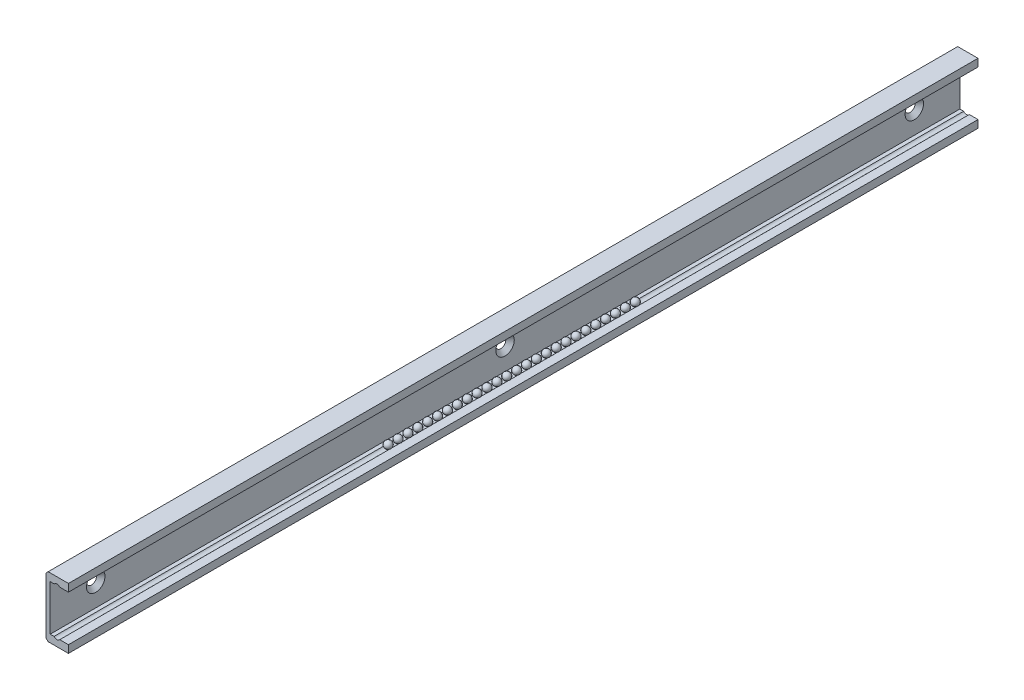
from build123d import *

# Parameters (mm, degrees)
BOSS_EXTRUDE1_DEPTH = 300


with BuildPart() as part:
    # Sketch1 → Boss-Extrude1 (new body)
    with BuildSketch(Plane.XY):
        with BuildLine():
            Line((-7.4, 0.707106781), (-6.692893219, 0))
            Line((-6.692893219, 0), (0, 0))
            Line((0, 0), (0, 2.5))
            Line((0, 2.5), (-2.8632503, 2.5))
            ThreePointArc((-2.8632503, 2.5), (-3.8, 2.05), (-4.7367497, 2.5))
            Line((-4.7367497, 2.5), (-6, 2.5))
            Line((-6, 2.5), (-6, 17.5))
            Line((-6, 17.5), (-4.7367497, 17.5))
            ThreePointArc((-4.7367497, 17.5), (-3.8, 17.95), (-2.8632503, 17.5))
            Line((-2.8632503, 17.5), (0, 17.5))
            Line((0, 17.5), (0, 20))
            Line((0, 20), (-6.692893219, 20))
            Line((-6.692893219, 20), (-7.4, 19.292893219))
            Line((-7.4, 19.292893219), (-7.4, 0.707106781))
        make_face()
    extrude(amount=BOSS_EXTRUDE1_DEPTH)

    # Sketch2 → Cut-Revolve1 (revolve, cut)
    with BuildSketch(Plane.XY.offset(15)):
        Polygon((-7.4, 10), (-7.4, 11.65), (-6, 13.05), (-6, 10), align=None)
    revolve(axis=Axis((-6, 10, 15), (-1, 0, 0)), mode=Mode.SUBTRACT)

    # Sketch3 → Cut-Revolve2 (revolve, cut)
    with BuildSketch(Plane.XY.offset(285)):
        Polygon((-7.4, 10), (-7.4, 11.65), (-6, 13.05), (-6, 10), align=None)
    revolve(axis=Axis((-6, 10, 285), (-1, 0, 0)), mode=Mode.SUBTRACT)

    # Sketch4 → Cut-Revolve3 (revolve, cut)
    with BuildSketch(Plane.XY.offset(150)):
        Polygon((-7.4, 10), (-7.4, 11.65), (-6, 13.05), (-6, 10), align=None)
    revolve(axis=Axis((-6, 10, 150), (-1, 0, 0)), mode=Mode.SUBTRACT)

    # Sketch5 → Revolve1 (revolve)
    with BuildSketch(Plane(origin=(0, 3.14999, 0), x_dir=(1, 0, 0), z_dir=(0, 1, 0))):
        with BuildLine():
            Line((-3.8, -110.45), (-3.8, -108.05))
            ThreePointArc((-3.8, -108.05), (-2.6, -109.25), (-3.8, -110.45))
        make_face()
    revolve(axis=Axis((-3.8, 3.14999, 110.45), (0, 0, -1)))

    # Sketch6 → Revolve2 (revolve)
    with BuildSketch(Plane(origin=(0, 3.14999, 0), x_dir=(1, 0, 0), z_dir=(0, 1, 0))):
        with BuildLine():
            Line((-3.8, -113.71), (-3.8, -111.31))
            ThreePointArc((-3.8, -111.31), (-2.6, -112.51), (-3.8, -113.71))
        make_face()
    revolve(axis=Axis((-3.8, 3.14999, 113.71), (0, 0, -1)))

    # Sketch7 → Revolve3 (revolve)
    with BuildSketch(Plane(origin=(0, 3.14999, 0), x_dir=(1, 0, 0), z_dir=(0, 1, 0))):
        with BuildLine():
            Line((-3.8, -116.97), (-3.8, -114.57))
            ThreePointArc((-3.8, -114.57), (-2.6, -115.77), (-3.8, -116.97))
        make_face()
    revolve(axis=Axis((-3.8, 3.14999, 116.97), (0, 0, -1)))

    # Sketch8 → Revolve4 (revolve)
    with BuildSketch(Plane(origin=(0, 3.14999, 0), x_dir=(1, 0, 0), z_dir=(0, 1, 0))):
        with BuildLine():
            Line((-3.8, -120.23), (-3.8, -117.83))
            ThreePointArc((-3.8, -117.83), (-2.6, -119.03), (-3.8, -120.23))
        make_face()
    revolve(axis=Axis((-3.8, 3.14999, 120.23), (0, 0, -1)))

    # Sketch9 → Revolve5 (revolve)
    with BuildSketch(Plane(origin=(0, 3.14999, 0), x_dir=(1, 0, 0), z_dir=(0, 1, 0))):
        with BuildLine():
            Line((-3.8, -123.49), (-3.8, -121.09))
            ThreePointArc((-3.8, -121.09), (-2.6, -122.29), (-3.8, -123.49))
        make_face()
    revolve(axis=Axis((-3.8, 3.14999, 123.49), (0, 0, -1)))

    # Sketch10 → Revolve6 (revolve)
    with BuildSketch(Plane(origin=(0, 3.14999, 0), x_dir=(1, 0, 0), z_dir=(0, 1, 0))):
        with BuildLine():
            Line((-3.8, -126.75), (-3.8, -124.35))
            ThreePointArc((-3.8, -124.35), (-2.6, -125.55), (-3.8, -126.75))
        make_face()
    revolve(axis=Axis((-3.8, 3.14999, 126.75), (0, 0, -1)))

    # Sketch11 → Revolve7 (revolve)
    with BuildSketch(Plane(origin=(0, 3.14999, 0), x_dir=(1, 0, 0), z_dir=(0, 1, 0))):
        with BuildLine():
            Line((-3.8, -130.01), (-3.8, -127.61))
            ThreePointArc((-3.8, -127.61), (-2.6, -128.81), (-3.8, -130.01))
        make_face()
    revolve(axis=Axis((-3.8, 3.14999, 130.01), (0, 0, -1)))

    # Sketch12 → Revolve8 (revolve)
    with BuildSketch(Plane(origin=(0, 3.14999, 0), x_dir=(1, 0, 0), z_dir=(0, 1, 0))):
        with BuildLine():
            Line((-3.8, -133.27), (-3.8, -130.87))
            ThreePointArc((-3.8, -130.87), (-2.6, -132.07), (-3.8, -133.27))
        make_face()
    revolve(axis=Axis((-3.8, 3.14999, 133.27), (0, 0, -1)))

    # Sketch13 → Revolve9 (revolve)
    with BuildSketch(Plane(origin=(0, 3.14999, 0), x_dir=(1, 0, 0), z_dir=(0, 1, 0))):
        with BuildLine():
            Line((-3.8, -136.53), (-3.8, -134.13))
            ThreePointArc((-3.8, -134.13), (-2.6, -135.33), (-3.8, -136.53))
        make_face()
    revolve(axis=Axis((-3.8, 3.14999, 136.53), (0, 0, -1)))

    # Sketch14 → Revolve10 (revolve)
    with BuildSketch(Plane(origin=(0, 3.14999, 0), x_dir=(1, 0, 0), z_dir=(0, 1, 0))):
        with BuildLine():
            Line((-3.8, -139.79), (-3.8, -137.39))
            ThreePointArc((-3.8, -137.39), (-2.6, -138.59), (-3.8, -139.79))
        make_face()
    revolve(axis=Axis((-3.8, 3.14999, 139.79), (0, 0, -1)))

    # Sketch15 → Revolve11 (revolve)
    with BuildSketch(Plane(origin=(0, 3.14999, 0), x_dir=(1, 0, 0), z_dir=(0, 1, 0))):
        with BuildLine():
            Line((-3.8, -143.05), (-3.8, -140.65))
            ThreePointArc((-3.8, -140.65), (-2.6, -141.85), (-3.8, -143.05))
        make_face()
    revolve(axis=Axis((-3.8, 3.14999, 143.05), (0, 0, -1)))

    # Sketch16 → Revolve12 (revolve)
    with BuildSketch(Plane(origin=(0, 3.14999, 0), x_dir=(1, 0, 0), z_dir=(0, 1, 0))):
        with BuildLine():
            Line((-3.8, -146.31), (-3.8, -143.91))
            ThreePointArc((-3.8, -143.91), (-2.6, -145.11), (-3.8, -146.31))
        make_face()
    revolve(axis=Axis((-3.8, 3.14999, 146.31), (0, 0, -1)))

    # Sketch17 → Revolve13 (revolve)
    with BuildSketch(Plane(origin=(0, 3.14999, 0), x_dir=(1, 0, 0), z_dir=(0, 1, 0))):
        with BuildLine():
            Line((-3.8, -149.57), (-3.8, -147.17))
            ThreePointArc((-3.8, -147.17), (-2.6, -148.37), (-3.8, -149.57))
        make_face()
    revolve(axis=Axis((-3.8, 3.14999, 149.57), (0, 0, -1)))

    # Sketch18 → Revolve14 (revolve)
    with BuildSketch(Plane(origin=(0, 3.14999, 0), x_dir=(1, 0, 0), z_dir=(0, 1, 0))):
        with BuildLine():
            Line((-3.8, -152.83), (-3.8, -150.43))
            ThreePointArc((-3.8, -150.43), (-2.6, -151.63), (-3.8, -152.83))
        make_face()
    revolve(axis=Axis((-3.8, 3.14999, 152.83), (0, 0, -1)))

    # Sketch19 → Revolve15 (revolve)
    with BuildSketch(Plane(origin=(0, 3.14999, 0), x_dir=(1, 0, 0), z_dir=(0, 1, 0))):
        with BuildLine():
            Line((-3.8, -156.09), (-3.8, -153.69))
            ThreePointArc((-3.8, -153.69), (-2.6, -154.89), (-3.8, -156.09))
        make_face()
    revolve(axis=Axis((-3.8, 3.14999, 156.09), (0, 0, -1)))

    # Sketch20 → Revolve16 (revolve)
    with BuildSketch(Plane(origin=(0, 3.14999, 0), x_dir=(1, 0, 0), z_dir=(0, 1, 0))):
        with BuildLine():
            Line((-3.8, -159.35), (-3.8, -156.95))
            ThreePointArc((-3.8, -156.95), (-2.6, -158.15), (-3.8, -159.35))
        make_face()
    revolve(axis=Axis((-3.8, 3.14999, 159.35), (0, 0, -1)))

    # Sketch21 → Revolve17 (revolve)
    with BuildSketch(Plane(origin=(0, 3.14999, 0), x_dir=(1, 0, 0), z_dir=(0, 1, 0))):
        with BuildLine():
            Line((-3.8, -162.61), (-3.8, -160.21))
            ThreePointArc((-3.8, -160.21), (-2.6, -161.41), (-3.8, -162.61))
        make_face()
    revolve(axis=Axis((-3.8, 3.14999, 162.61), (0, 0, -1)))

    # Sketch22 → Revolve18 (revolve)
    with BuildSketch(Plane(origin=(0, 3.14999, 0), x_dir=(1, 0, 0), z_dir=(0, 1, 0))):
        with BuildLine():
            Line((-3.8, -165.87), (-3.8, -163.47))
            ThreePointArc((-3.8, -163.47), (-2.6, -164.67), (-3.8, -165.87))
        make_face()
    revolve(axis=Axis((-3.8, 3.14999, 165.87), (0, 0, -1)))

    # Sketch23 → Revolve19 (revolve)
    with BuildSketch(Plane(origin=(0, 3.14999, 0), x_dir=(1, 0, 0), z_dir=(0, 1, 0))):
        with BuildLine():
            Line((-3.8, -169.13), (-3.8, -166.73))
            ThreePointArc((-3.8, -166.73), (-2.6, -167.93), (-3.8, -169.13))
        make_face()
    revolve(axis=Axis((-3.8, 3.14999, 169.13), (0, 0, -1)))

    # Sketch24 → Revolve20 (revolve)
    with BuildSketch(Plane(origin=(0, 3.14999, 0), x_dir=(1, 0, 0), z_dir=(0, 1, 0))):
        with BuildLine():
            Line((-3.8, -172.39), (-3.8, -169.99))
            ThreePointArc((-3.8, -169.99), (-2.6, -171.19), (-3.8, -172.39))
        make_face()
    revolve(axis=Axis((-3.8, 3.14999, 172.39), (0, 0, -1)))

    # Sketch25 → Revolve21 (revolve)
    with BuildSketch(Plane(origin=(0, 3.14999, 0), x_dir=(1, 0, 0), z_dir=(0, 1, 0))):
        with BuildLine():
            Line((-3.8, -175.65), (-3.8, -173.25))
            ThreePointArc((-3.8, -173.25), (-2.6, -174.45), (-3.8, -175.65))
        make_face()
    revolve(axis=Axis((-3.8, 3.14999, 175.65), (0, 0, -1)))

    # Sketch26 → Revolve22 (revolve)
    with BuildSketch(Plane(origin=(0, 3.14999, 0), x_dir=(1, 0, 0), z_dir=(0, 1, 0))):
        with BuildLine():
            Line((-3.8, -178.91), (-3.8, -176.51))
            ThreePointArc((-3.8, -176.51), (-2.6, -177.71), (-3.8, -178.91))
        make_face()
    revolve(axis=Axis((-3.8, 3.14999, 178.91), (0, 0, -1)))

    # Sketch27 → Revolve23 (revolve)
    with BuildSketch(Plane(origin=(0, 3.14999, 0), x_dir=(1, 0, 0), z_dir=(0, 1, 0))):
        with BuildLine():
            Line((-3.8, -182.17), (-3.8, -179.77))
            ThreePointArc((-3.8, -179.77), (-2.6, -180.97), (-3.8, -182.17))
        make_face()
    revolve(axis=Axis((-3.8, 3.14999, 182.17), (0, 0, -1)))

    # Sketch28 → Revolve24 (revolve)
    with BuildSketch(Plane(origin=(0, 3.14999, 0), x_dir=(1, 0, 0), z_dir=(0, 1, 0))):
        with BuildLine():
            Line((-3.8, -185.43), (-3.8, -183.03))
            ThreePointArc((-3.8, -183.03), (-2.6, -184.23), (-3.8, -185.43))
        make_face()
    revolve(axis=Axis((-3.8, 3.14999, 185.43), (0, 0, -1)))

    # Sketch29 → Revolve25 (revolve)
    with BuildSketch(Plane(origin=(0, 3.14999, 0), x_dir=(1, 0, 0), z_dir=(0, 1, 0))):
        with BuildLine():
            Line((-3.8, -188.69), (-3.8, -186.29))
            ThreePointArc((-3.8, -186.29), (-2.6, -187.49), (-3.8, -188.69))
        make_face()
    revolve(axis=Axis((-3.8, 3.14999, 188.69), (0, 0, -1)))

    # Sketch30 → Revolve26 (revolve)
    with BuildSketch(Plane(origin=(0, 3.14999, 0), x_dir=(1, 0, 0), z_dir=(0, 1, 0))):
        with BuildLine():
            Line((-3.8, -191.95), (-3.8, -189.55))
            ThreePointArc((-3.8, -189.55), (-2.6, -190.75), (-3.8, -191.95))
        make_face()
    revolve(axis=Axis((-3.8, 3.14999, 191.95), (0, 0, -1)))

    # Sketch31 → Revolve27 (revolve)
    with BuildSketch(Plane(origin=(0, 16.85001, 0), x_dir=(1, 0, 0), z_dir=(0, 1, 0))):
        with BuildLine():
            Line((-3.8, -110.45), (-3.8, -108.05))
            ThreePointArc((-3.8, -108.05), (-2.6, -109.25), (-3.8, -110.45))
        make_face()
    revolve(axis=Axis((-3.8, 16.85001, 110.45), (0, 0, -1)))

    # Sketch32 → Revolve28 (revolve)
    with BuildSketch(Plane(origin=(0, 16.85001, 0), x_dir=(1, 0, 0), z_dir=(0, 1, 0))):
        with BuildLine():
            Line((-3.8, -113.71), (-3.8, -111.31))
            ThreePointArc((-3.8, -111.31), (-2.6, -112.51), (-3.8, -113.71))
        make_face()
    revolve(axis=Axis((-3.8, 16.85001, 113.71), (0, 0, -1)))

    # Sketch33 → Revolve29 (revolve)
    with BuildSketch(Plane(origin=(0, 16.85001, 0), x_dir=(1, 0, 0), z_dir=(0, 1, 0))):
        with BuildLine():
            Line((-3.8, -116.97), (-3.8, -114.57))
            ThreePointArc((-3.8, -114.57), (-2.6, -115.77), (-3.8, -116.97))
        make_face()
    revolve(axis=Axis((-3.8, 16.85001, 116.97), (0, 0, -1)))

    # Sketch34 → Revolve30 (revolve)
    with BuildSketch(Plane(origin=(0, 16.85001, 0), x_dir=(1, 0, 0), z_dir=(0, 1, 0))):
        with BuildLine():
            Line((-3.8, -120.23), (-3.8, -117.83))
            ThreePointArc((-3.8, -117.83), (-2.6, -119.03), (-3.8, -120.23))
        make_face()
    revolve(axis=Axis((-3.8, 16.85001, 120.23), (0, 0, -1)))

    # Sketch35 → Revolve31 (revolve)
    with BuildSketch(Plane(origin=(0, 16.85001, 0), x_dir=(1, 0, 0), z_dir=(0, 1, 0))):
        with BuildLine():
            Line((-3.8, -123.49), (-3.8, -121.09))
            ThreePointArc((-3.8, -121.09), (-2.6, -122.29), (-3.8, -123.49))
        make_face()
    revolve(axis=Axis((-3.8, 16.85001, 123.49), (0, 0, -1)))

    # Sketch36 → Revolve32 (revolve)
    with BuildSketch(Plane(origin=(0, 16.85001, 0), x_dir=(1, 0, 0), z_dir=(0, 1, 0))):
        with BuildLine():
            Line((-3.8, -126.75), (-3.8, -124.35))
            ThreePointArc((-3.8, -124.35), (-2.6, -125.55), (-3.8, -126.75))
        make_face()
    revolve(axis=Axis((-3.8, 16.85001, 126.75), (0, 0, -1)))

    # Sketch37 → Revolve33 (revolve)
    with BuildSketch(Plane(origin=(0, 16.85001, 0), x_dir=(1, 0, 0), z_dir=(0, 1, 0))):
        with BuildLine():
            Line((-3.8, -130.01), (-3.8, -127.61))
            ThreePointArc((-3.8, -127.61), (-2.6, -128.81), (-3.8, -130.01))
        make_face()
    revolve(axis=Axis((-3.8, 16.85001, 130.01), (0, 0, -1)))

    # Sketch38 → Revolve34 (revolve)
    with BuildSketch(Plane(origin=(0, 16.85001, 0), x_dir=(1, 0, 0), z_dir=(0, 1, 0))):
        with BuildLine():
            Line((-3.8, -133.27), (-3.8, -130.87))
            ThreePointArc((-3.8, -130.87), (-2.6, -132.07), (-3.8, -133.27))
        make_face()
    revolve(axis=Axis((-3.8, 16.85001, 133.27), (0, 0, -1)))

    # Sketch39 → Revolve35 (revolve)
    with BuildSketch(Plane(origin=(0, 16.85001, 0), x_dir=(1, 0, 0), z_dir=(0, 1, 0))):
        with BuildLine():
            Line((-3.8, -136.53), (-3.8, -134.13))
            ThreePointArc((-3.8, -134.13), (-2.6, -135.33), (-3.8, -136.53))
        make_face()
    revolve(axis=Axis((-3.8, 16.85001, 136.53), (0, 0, -1)))

    # Sketch40 → Revolve36 (revolve)
    with BuildSketch(Plane(origin=(0, 16.85001, 0), x_dir=(1, 0, 0), z_dir=(0, 1, 0))):
        with BuildLine():
            Line((-3.8, -139.79), (-3.8, -137.39))
            ThreePointArc((-3.8, -137.39), (-2.6, -138.59), (-3.8, -139.79))
        make_face()
    revolve(axis=Axis((-3.8, 16.85001, 139.79), (0, 0, -1)))

    # Sketch41 → Revolve37 (revolve)
    with BuildSketch(Plane(origin=(0, 16.85001, 0), x_dir=(1, 0, 0), z_dir=(0, 1, 0))):
        with BuildLine():
            Line((-3.8, -143.05), (-3.8, -140.65))
            ThreePointArc((-3.8, -140.65), (-2.6, -141.85), (-3.8, -143.05))
        make_face()
    revolve(axis=Axis((-3.8, 16.85001, 143.05), (0, 0, -1)))

    # Sketch42 → Revolve38 (revolve)
    with BuildSketch(Plane(origin=(0, 16.85001, 0), x_dir=(1, 0, 0), z_dir=(0, 1, 0))):
        with BuildLine():
            Line((-3.8, -146.31), (-3.8, -143.91))
            ThreePointArc((-3.8, -143.91), (-2.6, -145.11), (-3.8, -146.31))
        make_face()
    revolve(axis=Axis((-3.8, 16.85001, 146.31), (0, 0, -1)))

    # Sketch43 → Revolve39 (revolve)
    with BuildSketch(Plane(origin=(0, 16.85001, 0), x_dir=(1, 0, 0), z_dir=(0, 1, 0))):
        with BuildLine():
            Line((-3.8, -149.57), (-3.8, -147.17))
            ThreePointArc((-3.8, -147.17), (-2.6, -148.37), (-3.8, -149.57))
        make_face()
    revolve(axis=Axis((-3.8, 16.85001, 149.57), (0, 0, -1)))

    # Sketch44 → Revolve40 (revolve)
    with BuildSketch(Plane(origin=(0, 16.85001, 0), x_dir=(1, 0, 0), z_dir=(0, 1, 0))):
        with BuildLine():
            Line((-3.8, -152.83), (-3.8, -150.43))
            ThreePointArc((-3.8, -150.43), (-2.6, -151.63), (-3.8, -152.83))
        make_face()
    revolve(axis=Axis((-3.8, 16.85001, 152.83), (0, 0, -1)))

    # Sketch45 → Revolve41 (revolve)
    with BuildSketch(Plane(origin=(0, 16.85001, 0), x_dir=(1, 0, 0), z_dir=(0, 1, 0))):
        with BuildLine():
            Line((-3.8, -156.09), (-3.8, -153.69))
            ThreePointArc((-3.8, -153.69), (-2.6, -154.89), (-3.8, -156.09))
        make_face()
    revolve(axis=Axis((-3.8, 16.85001, 156.09), (0, 0, -1)))

    # Sketch46 → Revolve42 (revolve)
    with BuildSketch(Plane(origin=(0, 16.85001, 0), x_dir=(1, 0, 0), z_dir=(0, 1, 0))):
        with BuildLine():
            Line((-3.8, -159.35), (-3.8, -156.95))
            ThreePointArc((-3.8, -156.95), (-2.6, -158.15), (-3.8, -159.35))
        make_face()
    revolve(axis=Axis((-3.8, 16.85001, 159.35), (0, 0, -1)))

    # Sketch47 → Revolve43 (revolve)
    with BuildSketch(Plane(origin=(0, 16.85001, 0), x_dir=(1, 0, 0), z_dir=(0, 1, 0))):
        with BuildLine():
            Line((-3.8, -162.61), (-3.8, -160.21))
            ThreePointArc((-3.8, -160.21), (-2.6, -161.41), (-3.8, -162.61))
        make_face()
    revolve(axis=Axis((-3.8, 16.85001, 162.61), (0, 0, -1)))

    # Sketch48 → Revolve44 (revolve)
    with BuildSketch(Plane(origin=(0, 16.85001, 0), x_dir=(1, 0, 0), z_dir=(0, 1, 0))):
        with BuildLine():
            Line((-3.8, -165.87), (-3.8, -163.47))
            ThreePointArc((-3.8, -163.47), (-2.6, -164.67), (-3.8, -165.87))
        make_face()
    revolve(axis=Axis((-3.8, 16.85001, 165.87), (0, 0, -1)))

    # Sketch49 → Revolve45 (revolve)
    with BuildSketch(Plane(origin=(0, 16.85001, 0), x_dir=(1, 0, 0), z_dir=(0, 1, 0))):
        with BuildLine():
            Line((-3.8, -169.13), (-3.8, -166.73))
            ThreePointArc((-3.8, -166.73), (-2.6, -167.93), (-3.8, -169.13))
        make_face()
    revolve(axis=Axis((-3.8, 16.85001, 169.13), (0, 0, -1)))

    # Sketch50 → Revolve46 (revolve)
    with BuildSketch(Plane(origin=(0, 16.85001, 0), x_dir=(1, 0, 0), z_dir=(0, 1, 0))):
        with BuildLine():
            Line((-3.8, -172.39), (-3.8, -169.99))
            ThreePointArc((-3.8, -169.99), (-2.6, -171.19), (-3.8, -172.39))
        make_face()
    revolve(axis=Axis((-3.8, 16.85001, 172.39), (0, 0, -1)))

    # Sketch51 → Revolve47 (revolve)
    with BuildSketch(Plane(origin=(0, 16.85001, 0), x_dir=(1, 0, 0), z_dir=(0, 1, 0))):
        with BuildLine():
            Line((-3.8, -175.65), (-3.8, -173.25))
            ThreePointArc((-3.8, -173.25), (-2.6, -174.45), (-3.8, -175.65))
        make_face()
    revolve(axis=Axis((-3.8, 16.85001, 175.65), (0, 0, -1)))

    # Sketch52 → Revolve48 (revolve)
    with BuildSketch(Plane(origin=(0, 16.85001, 0), x_dir=(1, 0, 0), z_dir=(0, 1, 0))):
        with BuildLine():
            Line((-3.8, -178.91), (-3.8, -176.51))
            ThreePointArc((-3.8, -176.51), (-2.6, -177.71), (-3.8, -178.91))
        make_face()
    revolve(axis=Axis((-3.8, 16.85001, 178.91), (0, 0, -1)))

    # Sketch53 → Revolve49 (revolve)
    with BuildSketch(Plane(origin=(0, 16.85001, 0), x_dir=(1, 0, 0), z_dir=(0, 1, 0))):
        with BuildLine():
            Line((-3.8, -182.17), (-3.8, -179.77))
            ThreePointArc((-3.8, -179.77), (-2.6, -180.97), (-3.8, -182.17))
        make_face()
    revolve(axis=Axis((-3.8, 16.85001, 182.17), (0, 0, -1)))

    # Sketch54 → Revolve50 (revolve)
    with BuildSketch(Plane(origin=(0, 16.85001, 0), x_dir=(1, 0, 0), z_dir=(0, 1, 0))):
        with BuildLine():
            Line((-3.8, -185.43), (-3.8, -183.03))
            ThreePointArc((-3.8, -183.03), (-2.6, -184.23), (-3.8, -185.43))
        make_face()
    revolve(axis=Axis((-3.8, 16.85001, 185.43), (0, 0, -1)))

    # Sketch55 → Revolve51 (revolve)
    with BuildSketch(Plane(origin=(0, 16.85001, 0), x_dir=(1, 0, 0), z_dir=(0, 1, 0))):
        with BuildLine():
            Line((-3.8, -188.69), (-3.8, -186.29))
            ThreePointArc((-3.8, -186.29), (-2.6, -187.49), (-3.8, -188.69))
        make_face()
    revolve(axis=Axis((-3.8, 16.85001, 188.69), (0, 0, -1)))

    # Sketch56 → Revolve52 (revolve)
    with BuildSketch(Plane(origin=(0, 16.85001, 0), x_dir=(1, 0, 0), z_dir=(0, 1, 0))):
        with BuildLine():
            Line((-3.8, -191.95), (-3.8, -189.55))
            ThreePointArc((-3.8, -189.55), (-2.6, -190.75), (-3.8, -191.95))
        make_face()
    revolve(axis=Axis((-3.8, 16.85001, 191.95), (0, 0, -1)))


solid = part.part
